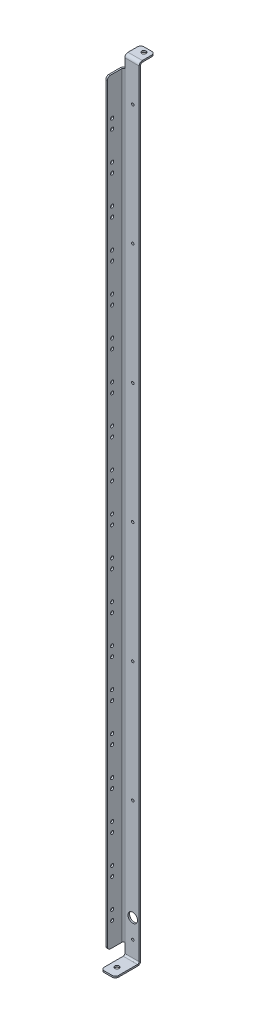
from build123d import *

# Parameters (mm, degrees)
BASE_FLANGE1_DEPTH           = 1565.275
SKETCH6_W                    = 6.35
SKETCH6_H                    = 25.4
CUT_EXTRUDE1_DEPTH           = 50.8
EDGE_FLANGE1_STRIP_W         = 19.05
EDGE_FLANGE1_STRIP_H         = 3.175
EDGE_FLANGE1_STRIP_CUT_DEPTH = 28.575
EDGE_FLANGE1_DEPTH           = 28.575
FILLET1_R                    = 6.35
SKETCH10_R                   = 2.4511
SKETCH10_R_2                 = 9.525
CUT_EXTRUDE2_DEPTH           = 50.8
SKETCH11_R                   = 4.3688
CUT_EXTRUDE3_DEPTH           = 50.8
SKETCH12_R                   = 3.175
CUT_EXTRUDE4_DEPTH           = 50.8
EDGE_FLANGE3_STRIP_W         = 19.05
EDGE_FLANGE3_STRIP_H         = 3.175
EDGE_FLANGE3_STRIP_CUT_DEPTH = 28.575
EDGE_FLANGE3_DEPTH           = 28.575
FILLET2_R                    = 6.35
SKETCH21_R                   = 4.3688
CUT_EXTRUDE5_DEPTH           = 6.35


# Sheet-metal steps are written as plain solids
with BuildPart() as part:
    # Sketch1 → Base-Flange1 (new body)
    with BuildSketch(Plane(origin=(0, 0, 0), x_dir=(1, 0, 0), z_dir=(0, 1, 0))):
        with BuildLine():
            Line((0, -34.925), (0, -6.35))
            ThreePointArc((0, -6.35), (1.859871939, -1.859871939), (6.35, 0))
            Line((6.35, 0), (34.925, 0))
            Line((34.925, 0), (34.925, -3.175))
            Line((34.925, -3.175), (6.35, -3.175))
            ThreePointArc((6.35, -3.175), (4.10493597, -4.10493597), (3.175, -6.35))
            Line((3.175, -6.35), (3.175, -34.925))
            Line((3.175, -34.925), (0, -34.925))
        make_face()
    extrude(amount=BASE_FLANGE1_DEPTH)

    # Sketch6 → Cut-Extrude1 (cut)
    with BuildSketch(Plane(origin=(0, 0, 0), x_dir=(-1, 0, 0), z_dir=(0, 0, -1))):
        with Locations((-3.175, 12.7)):
            Rectangle(SKETCH6_W, SKETCH6_H)
        with Locations((-3.175, 1552.575)):
            Rectangle(SKETCH6_W, SKETCH6_H)
    extrude(amount=-CUT_EXTRUDE1_DEPTH, mode=Mode.SUBTRACT)

    # Edge-Flange1 strip (across the edge) → Edge-Flange1 strip cut (cut)
    with BuildSketch(Plane(origin=(6.35, 0, 3.175), x_dir=(0, 1, 0), z_dir=(1, 0, 0))):
        with Locations((-3.175, -1.5875)):
            Rectangle(EDGE_FLANGE1_STRIP_W, EDGE_FLANGE1_STRIP_H)
    extrude(amount=EDGE_FLANGE1_STRIP_CUT_DEPTH, mode=Mode.SUBTRACT)

    # Edge-Flange1 section (across the edge) → Edge-Flange1 (add)
    with BuildSketch(Plane(origin=(6.35, 0, 3.175), x_dir=(0, 1, 0), z_dir=(1, 0, 0))):
        with BuildLine():
            Line((0, 3.175), (0, 47.625))
            Line((0, 47.625), (3.175, 47.625))
            Line((3.175, 47.625), (3.175, 3.175))
            ThreePointArc((3.175, 3.175), (4.10493597, 0.92993597), (6.35, 0))
            Line((6.35, 0), (6.35, -3.175))
            ThreePointArc((6.35, -3.175), (1.859871939, -1.315128061), (0, 3.175))
        make_face()
    extrude(amount=EDGE_FLANGE1_DEPTH)

    # Fillet1
    fillet1_edges = [part.edges().sort_by_distance(p)[0] for p in [
        (6.35, 1.5875, 50.8),
        (34.925, 1.5875, 50.8),
        (1.5875, 25.4, 34.925),
        (1.5875, 1539.875, 34.925),
    ]]
    fillet(fillet1_edges, radius=FILLET1_R)

    # Sketch10 → Cut-Extrude2 (cut)
    with BuildSketch(Plane.XY.offset(3.175)):
        with Locations((22.225, 38.1)):
            Circle(SKETCH10_R)
        with Locations((22.225, 279.4)):
            Circle(SKETCH10_R)
        with Locations((22.225, 520.7)):
            Circle(SKETCH10_R)
        with Locations((22.225, 762)):
            Circle(SKETCH10_R)
        with Locations((22.225, 1003.3)):
            Circle(SKETCH10_R)
        with Locations((22.225, 1244.6)):
            Circle(SKETCH10_R)
        with Locations((22.225, 1485.9)):
            Circle(SKETCH10_R)
        with Locations((22.225, 76.2)):
            Circle(SKETCH10_R_2)
    extrude(amount=-CUT_EXTRUDE2_DEPTH, mode=Mode.SUBTRACT)

    # Sketch11 → Cut-Extrude3 (cut)
    with BuildSketch(Plane.XZ):
        with Locations(Location((19.05, 31.75, 0), (0, 0, 270))):
            Circle(SKETCH11_R)
    extrude(amount=-CUT_EXTRUDE3_DEPTH, mode=Mode.SUBTRACT)

    # Sketch12 → Cut-Extrude4 (cut)
    with BuildSketch(Plane(origin=(3.175, 0, 0), x_dir=(0, 0, -1), z_dir=(1, 0, 0))):
        with Locations((-25.4, 73.025)):
            Circle(SKETCH12_R)
        with Locations((-25.4, 92.075)):
            Circle(SKETCH12_R)
        with Locations((-25.4, 149.225)):
            Circle(SKETCH12_R)
        with Locations((-25.4, 168.275)):
            Circle(SKETCH12_R)
        with Locations((-25.4, 225.425)):
            Circle(SKETCH12_R)
        with Locations((-25.4, 244.475)):
            Circle(SKETCH12_R)
        with Locations((-25.4, 301.625)):
            Circle(SKETCH12_R)
        with Locations((-25.4, 320.675)):
            Circle(SKETCH12_R)
        with Locations((-25.4, 377.825)):
            Circle(SKETCH12_R)
        with Locations((-25.4, 396.875)):
            Circle(SKETCH12_R)
        with Locations((-25.4, 454.025)):
            Circle(SKETCH12_R)
        with Locations((-25.4, 473.075)):
            Circle(SKETCH12_R)
        with Locations((-25.4, 530.225)):
            Circle(SKETCH12_R)
        with Locations((-25.4, 549.275)):
            Circle(SKETCH12_R)
        with Locations((-25.4, 606.425)):
            Circle(SKETCH12_R)
        with Locations((-25.4, 625.475)):
            Circle(SKETCH12_R)
        with Locations((-25.4, 682.625)):
            Circle(SKETCH12_R)
        with Locations((-25.4, 701.675)):
            Circle(SKETCH12_R)
        with Locations((-25.4, 758.825)):
            Circle(SKETCH12_R)
        with Locations((-25.4, 777.875)):
            Circle(SKETCH12_R)
        with Locations((-25.4, 835.025)):
            Circle(SKETCH12_R)
        with Locations((-25.4, 854.075)):
            Circle(SKETCH12_R)
        with Locations((-25.4, 911.225)):
            Circle(SKETCH12_R)
        with Locations((-25.4, 930.275)):
            Circle(SKETCH12_R)
        with Locations((-25.4, 987.425)):
            Circle(SKETCH12_R)
        with Locations((-25.4, 1006.475)):
            Circle(SKETCH12_R)
        with Locations((-25.4, 1063.625)):
            Circle(SKETCH12_R)
        with Locations((-25.4, 1082.675)):
            Circle(SKETCH12_R)
        with Locations((-25.4, 1139.825)):
            Circle(SKETCH12_R)
        with Locations((-25.4, 1158.875)):
            Circle(SKETCH12_R)
        with Locations((-25.4, 1216.025)):
            Circle(SKETCH12_R)
        with Locations((-25.4, 1235.075)):
            Circle(SKETCH12_R)
        with Locations((-25.4, 1292.225)):
            Circle(SKETCH12_R)
        with Locations((-25.4, 1311.275)):
            Circle(SKETCH12_R)
        with Locations((-25.4, 1368.425)):
            Circle(SKETCH12_R)
        with Locations((-25.4, 1387.475)):
            Circle(SKETCH12_R)
        with Locations((-25.4, 1444.625)):
            Circle(SKETCH12_R)
        with Locations((-25.4, 1463.675)):
            Circle(SKETCH12_R)
    extrude(amount=-CUT_EXTRUDE4_DEPTH, mode=Mode.SUBTRACT)

    # Edge-Flange3 strip (across the edge) → Edge-Flange3 strip cut (cut)
    with BuildSketch(Plane(origin=(6.35, 1565.275, 0), x_dir=(0, -1, 0), z_dir=(1, 0, 0))):
        with Locations((-3.175, -1.5875)):
            Rectangle(EDGE_FLANGE3_STRIP_W, EDGE_FLANGE3_STRIP_H)
    extrude(amount=EDGE_FLANGE3_STRIP_CUT_DEPTH, mode=Mode.SUBTRACT)

    # Edge-Flange3 section (across the edge) → Edge-Flange3 (add)
    with BuildSketch(Plane(origin=(6.35, 1565.275, 0), x_dir=(0, -1, 0), z_dir=(1, 0, 0))):
        with BuildLine():
            Line((0, 3.175), (0, 28.575))
            Line((0, 28.575), (3.175, 28.575))
            Line((3.175, 28.575), (3.175, 3.175))
            ThreePointArc((3.175, 3.175), (4.10493597, 0.92993597), (6.35, 0))
            Line((6.35, 0), (6.35, -3.175))
            ThreePointArc((6.35, -3.175), (1.859871939, -1.315128061), (0, 3.175))
        make_face()
    extrude(amount=EDGE_FLANGE3_DEPTH)

    # Fillet2
    fillet2_edges = [part.edges().sort_by_distance(p)[0] for p in [
        (6.35, 1563.6875, -28.575),
        (34.925, 1563.6875, -28.575),
    ]]
    fillet(fillet2_edges, radius=FILLET2_R)

    # Sketch21 → Cut-Extrude5 (cut)
    with BuildSketch(Plane(origin=(0, 1565.275, 0), x_dir=(1, 0, 0), z_dir=(0, 1, 0))):
        with Locations(Location((22.225, 19.05, 0), (0, 0, 270))):
            Circle(SKETCH21_R)
    extrude(amount=-CUT_EXTRUDE5_DEPTH, mode=Mode.SUBTRACT)


solid = part.part
